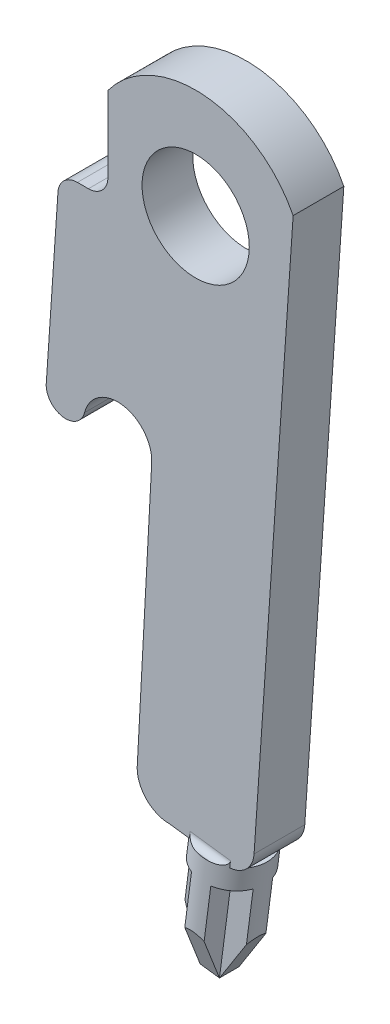
from build123d import *

# Parameters (mm, degrees)
SKETCH1_R           = 2.0955
BOSS_EXTRUDE1_DEPTH = 1.9812
FILLET1_R           = 0.762
SKETCH3_R           = 1.27
BOSS_EXTRUDE2_DEPTH = 4.6355
SKETCH5_W           = 0.830502785
SKETCH5_H           = 0.830502786
CUT_EXTRUDE1_DEPTH  = 3.81
CUT_EXTRUDE2_DEPTH  = 3.81
CIRPATTERN1_COUNT   = 4
FILLET3_R           = 0.254


with BuildPart() as part:
    # Sketch1 → Boss-Extrude1 (new body)
    with BuildSketch(Plane.XY):
        with BuildLine():
            Line((45.760103821, 50.326590864), (45.760103821, 46.618317867))
            Line((45.760103821, 46.618317867), (43.856665355, 46.618317867))
            Line((43.856665355, 46.618317867), (43.347103821, 39.150717867))
            ThreePointArc((43.347103821, 39.150717867), (44.016000174, 38.394427109), (44.848352407, 38.965905721))
            ThreePointArc((44.848352407, 38.965905721), (46.339305619, 39.960432804), (47.471727095, 38.571315385))
            Line((47.471727095, 38.571315385), (46.903103821, 27.974717867))
            ThreePointArc((46.903103821, 27.974717867), (47.275078209, 27.076692255), (48.173103821, 26.704717867))
            Line((48.173103821, 26.704717867), (50.12121108, 26.450717867))
            ThreePointArc((50.12121108, 26.450717867), (51.01744047, 26.560052876), (51.472746702, 27.339717867))
            Line((51.472746702, 27.339717867), (52.999103821, 49.708408747))
            ThreePointArc((52.999103821, 49.708408747), (49.552184435, 52.0384432), (45.760103821, 50.326590864))
        make_face()
        with Locations((49.189103821, 47.786717867)):
            Circle(SKETCH1_R, mode=Mode.SUBTRACT)
    extrude(amount=BOSS_EXTRUDE1_DEPTH)

    # Fillet1
    fillet1_edges = [part.edges().sort_by_distance(p)[0] for p in [
        (43.856665355, 46.618317867, 0.9906),
        (45.760103821, 46.618317867, 0.9906),
    ]]
    fillet(fillet1_edges, radius=FILLET1_R)

    # Sketch3 → Boss-Extrude2 (add)
    with BuildSketch(Plane(origin=(4.228879683, 32.434296092, 0), x_dir=(0.9916069999104432, -0.12928866047960397, 0), z_dir=(-0.12928866047960397, -0.9916069999104432, 0))):
        with Locations(Location((45.888507166, 0.9906, 0), (0, 0, 231.260575402))):
            Circle(SKETCH3_R)
    extrude(amount=BOSS_EXTRUDE2_DEPTH)

    # Sketch5 → Cut-Extrude1 (cut)
    with BuildSketch(Plane(origin=(3.629562097, 27.837701844, 0), x_dir=(0.9916069999104432, -0.129288660479604, 0), z_dir=(-0.129288660479604, -0.9916069999104432, 0))):
        with Locations((46.684758559, 1.786851393)):
            Rectangle(SKETCH5_W, SKETCH5_H)
    cut_extrude1 = extrude(amount=-CUT_EXTRUDE1_DEPTH, mode=Mode.SUBTRACT)

    # Sketch6 → Cut-Extrude2 (cut)
    with BuildSketch(Plane(origin=(45.881167188, -5.982122602, 0), x_dir=(0, 0, -1), z_dir=(0.9916069999104432, -0.129288660479604, 0))):
        Polygon((-1.3716, 28.073321232), (-2.2606, 29.978321232), (-2.2606, 28.073321232), align=None)
    cut_extrude2 = extrude(amount=-CUT_EXTRUDE2_DEPTH, mode=Mode.SUBTRACT)

    # CirPattern1: Cut-Extrude1, Cut-Extrude2 ×4 about axis
    cirpattern1_axis = Axis((45.503364921, -5.932863623, 0.9906), (0.1292886604796056, 0.991606999910443, 0))
    add([cut_extrude1.rotate(cirpattern1_axis, i * 360 / CIRPATTERN1_COUNT) for i in range(1, CIRPATTERN1_COUNT)], mode=Mode.SUBTRACT)
    add([cut_extrude2.rotate(cirpattern1_axis, i * 360 / CIRPATTERN1_COUNT) for i in range(1, CIRPATTERN1_COUNT)], mode=Mode.SUBTRACT)

    # Fillet3
    # the kernel refuses this fillet: 0.254 mm, written as the material it adds along each edge
    with BuildSketch(Plane(origin=(48.314504429, 26.686281636, 1.9812), x_dir=(0.1292886604796056, 0.9916069999104429, 0), z_dir=(0.991606999910443, -0.1292886604796056, -1.1175710787249272e-14))) as fillet3_piece_1_section:
        with BuildLine():
            CenterArc((FILLET3_R, FILLET3_R), FILLET3_R, 180, 90)
            Line((0, FILLET3_R), (0, 0))
            Line((0, 0), (FILLET3_R, 0))
        make_face()
    fillet3_piece_1 = extrude(amount=2.859479965, mode=Mode.PRIVATE)
    fillet3_piece_1 = fillet3_piece_1 & Plane(origin=(49.739170081, 26.554548895, 0.9906), x_dir=(-0.6205273463723372, 0.08090619510621488, -0.7799999999984234), z_dir=(0.12928866047960397, 0.9916069999104432, 0)) * Cylinder(1.27, 7, mode=Mode.PRIVATE)
    add(fillet3_piece_1)
    with BuildSketch(Plane(origin=(51.149984779, 26.316583302, 0), x_dir=(0.12928866047960436, 0.9916069999104431, 0), z_dir=(-0.9916069999104432, 0.12928866047960438, 1.2608297213769615e-12))) as fillet3_piece_2_section:
        with BuildLine():
            CenterArc((FILLET3_R, FILLET3_R), FILLET3_R, 180, 90)
            Line((0, FILLET3_R), (0, 0))
            Line((0, 0), (FILLET3_R, 0))
        make_face()
    fillet3_piece_2 = extrude(amount=2.859479965, mode=Mode.PRIVATE)
    fillet3_piece_2 = fillet3_piece_2 & Plane(origin=(49.73917008, 26.554548887, 0.9906), x_dir=(-0.6205273463723372, 0.08090619510621488, -0.7799999999984234), z_dir=(0.12928866047960397, 0.9916069999104432, 0)) * Cylinder(1.27, 7, mode=Mode.PRIVATE)
    add(fillet3_piece_2)


solid = part.part
